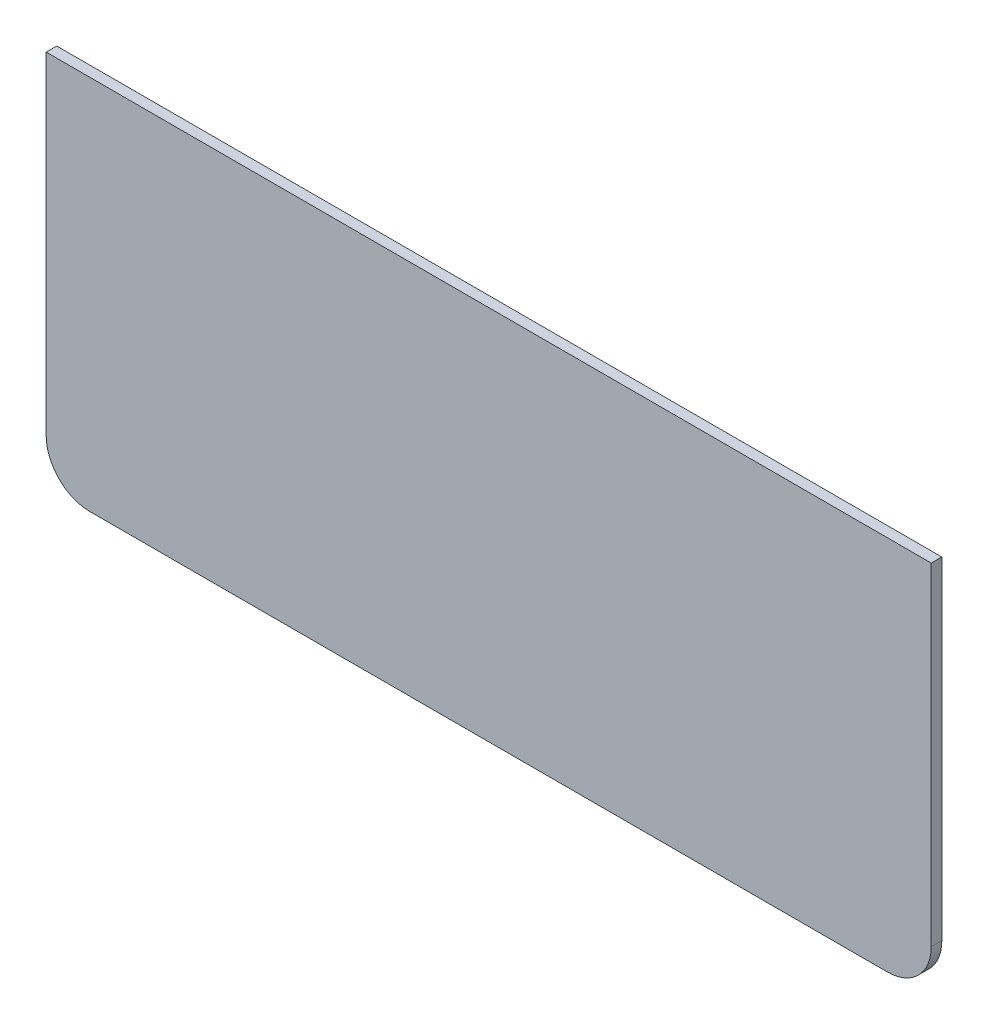
from build123d import *

# Parameters (mm, degrees)
SKETCH2_W           = 266.35
SKETCH2_H           = 113.175
BOSS_EXTRUDE1_DEPTH = 3.175
FILLET1_R           = 13.175


with BuildPart() as part:
    # Sketch2 → Boss-Extrude1 (new body)
    with BuildSketch(Plane.XY):
        with Locations((79.588397155, -16.051971223)):
            Rectangle(SKETCH2_W, SKETCH2_H)
    extrude(amount=BOSS_EXTRUDE1_DEPTH)

    # Fillet1
    fillet1_edges = [part.edges().sort_by_distance(p)[0] for p in [
        (-53.586602845, -72.639471223, 1.5875),
        (212.763397155, -72.639471223, 1.5875),
    ]]
    fillet(fillet1_edges, radius=FILLET1_R)


solid = part.part
